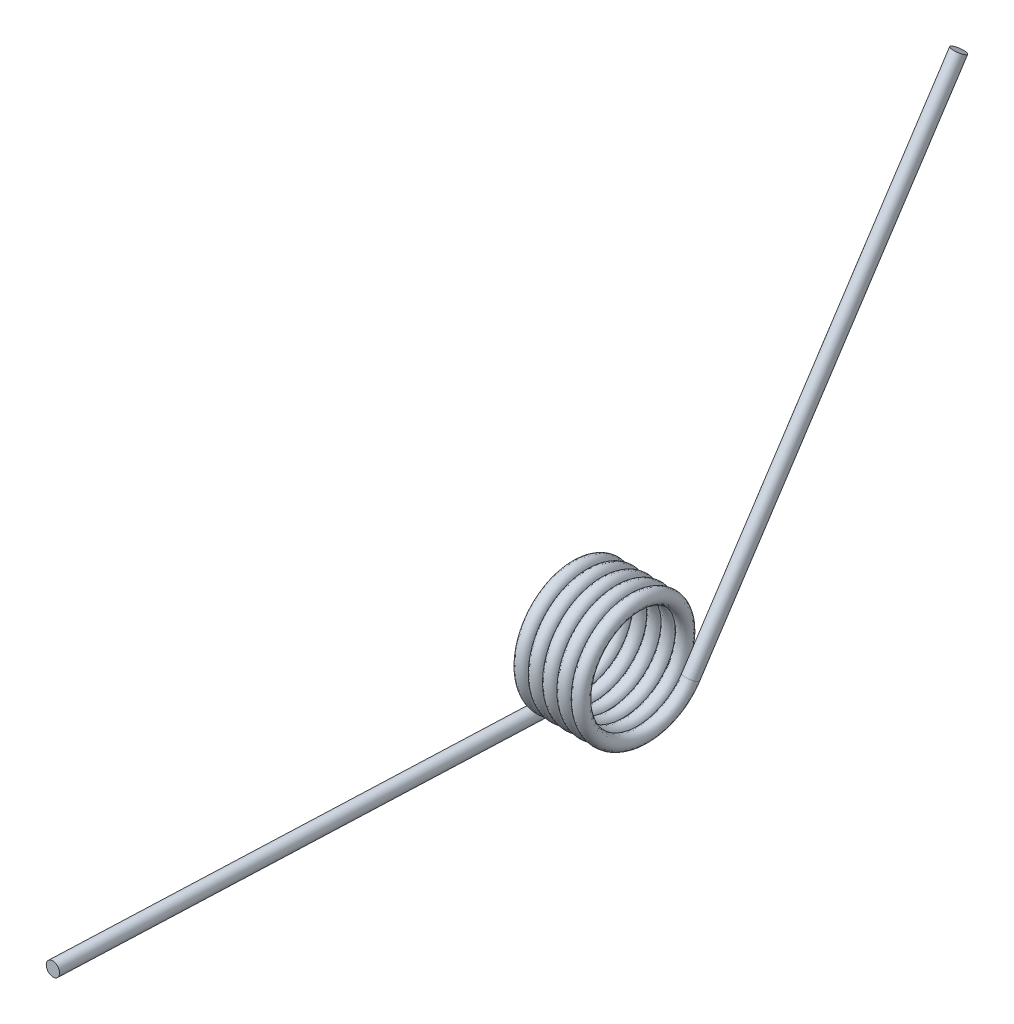
from build123d import *

# Parameters (mm, degrees)
SWEEP1_PITCH   = 0.9144
SKETCH3_R      = 0.4445
EXTRUDE1_DEPTH = 31.75
SKETCH4_R      = 0.4445
EXTRUDE2_DEPTH = 31.75


with BuildPart() as part:
    # Sweep1: arcs per turn and ends read off the stored shape
    # Sweep1: the profile of Sketch2 screwed along a right-hand helix through 5.166667 turns, 6 arcs to a turn; built about Z, then put on its axis
    sweep1_z = Axis((0, 0, 0), (0, 0, 1))
    sweep1_corners = [(3.516484246, -0.018104228, 0.442369746), (3.998740054, -0.001615852, 0.039482703), (3.595515754, 0.018104228, -0.442369746), (3.113259946, 0.001615852, -0.039482703)]
    with BuildLine(mode=Mode.PRIVATE) as sweep1_profile:
        ThreePointArc((3.516484246, -0.018104228, 0.442369746), (3.841122637, -0.013944202, 0.340721134), (3.998740054, -0.001615852, 0.039482703))
        ThreePointArc((3.998740054, -0.001615852, 0.039482703), (3.897006352, 0.011659043, -0.28488416), (3.595515754, 0.018104228, -0.442369746))
        ThreePointArc((3.595515754, 0.018104228, -0.442369746), (3.270877363, 0.013944202, -0.340721134), (3.113259946, 0.001615852, -0.039482703))
        ThreePointArc((3.113259946, 0.001615852, -0.039482703), (3.214993648, -0.011659043, 0.28488416), (3.516484246, -0.018104228, 0.442369746))
    sweep1_cap = Face(sweep1_profile.wire())
    sweep1_arcs = [((3.516484246, -0.018104228, 0.442369746), (3.9592243, -0.01972008, 0.481852449), (3.998740054, -0.001615852, 0.039482703), (1, 0.7071067811865475, 1)), ((3.998740054, -0.001615852, 0.039482703), (4.038255807, 0.016488377, -0.402887043), (3.595515754, 0.018104228, -0.442369746), (1, 0.7071067811865475, 1)), ((3.595515754, 0.018104228, -0.442369746), (3.1527757, 0.01972008, -0.481852449), (3.113259946, 0.001615852, -0.039482703), (1, 0.7071067811865475, 1)), ((3.113259946, 0.001615852, -0.039482703), (3.073744193, -0.016488377, 0.402887043), (3.516484246, -0.018104228, 0.442369746), (1, 0.7071067811865475, 1))]  # start, shoulder, end, weights
    sweep1_turn_angles = [0, 30, 60, 90, 120, 150, 180, 210, 240, 270, 300, 330, 360]
    sweep1_turn_weights = [1, 0.8660254037844387, 1, 0.8660254037844387, 1, 0.8660254037844387, 1, 0.8660254037844387, 1, 0.8660254037844387, 1, 0.8660254037844387, 1]
    sweep1_turn_sides = [Face.make_bezier_surface([[Vector(p[j][0], p[j][1], 0).rotate(sweep1_z, sweep1_turn_angles[2 * i + k]) / sweep1_turn_weights[2 * i + k] + Vector(0, 0, p[j][2] + SWEEP1_PITCH * sweep1_turn_angles[2 * i + k] / 360) for k in range(3)] for j in range(3)], [[p[3][j] * sweep1_turn_weights[2 * i + k] for k in range(3)] for j in range(3)]) for p in sweep1_arcs for i in range(6)]
    sweep1_last_angles = [1800, 1830, 1860]
    sweep1_last_weights = [1, 0.8660254037844168, 1]
    sweep1_last_sides = [Face.make_bezier_surface([[Vector(p[j][0], p[j][1], 0).rotate(sweep1_z, sweep1_last_angles[2 * i + k]) / sweep1_last_weights[2 * i + k] + Vector(0, 0, p[j][2] + SWEEP1_PITCH * sweep1_last_angles[2 * i + k] / 360) for k in range(3)] for j in range(3)], [[p[3][j] * sweep1_last_weights[2 * i + k] for k in range(3)] for j in range(3)]) for p in sweep1_arcs for i in range(1)]
    sweep1 = Plane(origin=(0, 0, 0), x_dir=(0, -1, 0), z_dir=(1, 0, 0)) * Solid(Shell([*[p.moved(Location((0, 0, SWEEP1_PITCH * i))) for i in range(5) for p in sweep1_turn_sides], *sweep1_last_sides, sweep1_cap, sweep1_cap.rotate(sweep1_z, 1860).moved(Location((0, 0, SWEEP1_PITCH * 1860 / 360)))]))
    add(sweep1)

    # Sketch3 → Extrude1 (add)
    with BuildSketch(Plane(origin=(0, 0, 0), x_dir=(-0.9952075274498319, -0.08889933338030678, -0.04072942218751907), z_dir=(-0.0408913266560652, -1.1153838269661875e-14, 0.9991635999196062))):
        with Locations(Location((0.31612603, 3.54192043, 0), (0, 0, 354.899710282))):
            Circle(SKETCH3_R)
    extrude(amount=EXTRUDE1_DEPTH)

    # Sketch4 → Extrude2 (add)
    with BuildSketch(Plane(origin=(0.007899672, 0.167164902, -0.096512701), x_dir=(0.9927098026516717, -0.09192191454557262, -0.077959023503091), z_dir=(0.0408913266560652, 0.8653010600671337, -0.499581799959728))):
        with Locations(Location((5.093476899, 2.997376057, 0), (0, 0, 173.484300733))):
            Circle(SKETCH4_R)
    extrude(amount=EXTRUDE2_DEPTH)


solid = part.part
